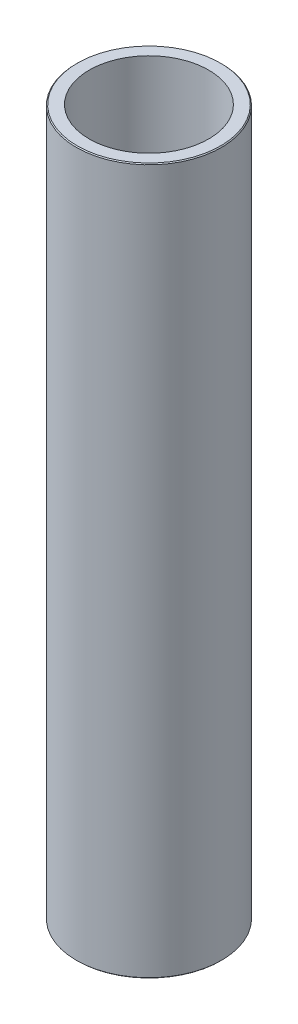
from build123d import *

# Parameters (mm, degrees)
SKETCH1_R           = 57.5
BOSS_EXTRUDE1_DEPTH = 559.195337416
SKETCH2_R           = 47.332576366
CUT_EXTRUDE1_DEPTH  = 566.076919886
CHAMFER1_SIZE       = 0.721805812


with BuildPart() as part:
    # Sketch1 → Boss-Extrude1 (new body)
    with BuildSketch(Plane(origin=(0, 0, 0), x_dir=(1, 0, 0), z_dir=(0, 1, 0))):
        Circle(SKETCH1_R)
    extrude(amount=BOSS_EXTRUDE1_DEPTH)

    # Sketch2 → Cut-Extrude1 (cut, through all)
    with BuildSketch(Plane(origin=(0, 0, 0), x_dir=(1, 0, 0), z_dir=(0, 1, 0))):
        Circle(SKETCH2_R)
    extrude(amount=CUT_EXTRUDE1_DEPTH, mode=Mode.SUBTRACT)

    # Chamfer1
    chamfer1_edges = [part.edges().sort_by_distance(p)[0] for p in [
        (-57.5, 559.195337416, 0),
        (-57.5, 0, 0),
    ]]
    chamfer(chamfer1_edges, length=CHAMFER1_SIZE)


solid = part.part
